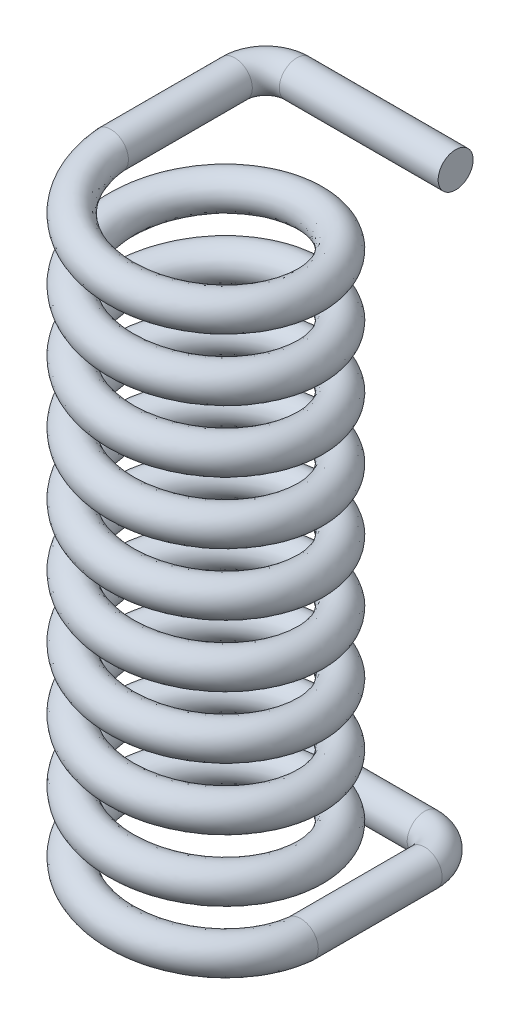
from build123d import *

# Parameters (mm, degrees)
SWEEP1_PITCH       = 4
SWEEP1_HEIGHT      = 38
SWEEP1_RADIUS      = 6.13
SWEEP1_START_ANGLE = 90
SKETCH1_R          = 1.13
SKETCH1_3_R        = 1.13
SWEEP3_OUTLINE_R   = 1.13
SWEEP3_ANGLE       = 90
SWEEP3_START       = -8.0000001
SWEEP3_2_OUTLINE_R = 1.13
SWEEP3_2_DEPTH     = 8.0000001
SWEEP3_START_2     = -4.1300001
SWEEP3_3_OUTLINE_R = 1.13
SWEEP3_3_DEPTH     = 10.2600001


with BuildPart() as part:
    # Sweep1: sweep along a helix
    with BuildLine() as sweep1_path:
        add(Helix(SWEEP1_PITCH, SWEEP1_HEIGHT, SWEEP1_RADIUS, center=(0, 0, 0), direction=(0, 1, 0), lefthand=True, mode=Mode.PRIVATE).rotate(Axis((0, 0, 0), (0, 1, 0)), SWEEP1_START_ANGLE))
    # Sketch1 → Sweep1 (sweep)
    with BuildSketch(Plane.XY):
        with Locations((6.13, 0)):
            Circle(SKETCH1_R)
    sweep(path=sweep1_path.line, is_frenet=True)

    # Sweep2: sweep along a path in Sketch3
    with BuildLine(Plane(origin=(0, 0, 0), x_dir=(1, 0, 0), z_dir=(0, 1, 0))) as sweep2_path:
        Line((6.13, 0), (6.13, 8))
        ThreePointArc((6.13, 8), (5.544213562, 9.414213562), (4.13, 10))
        Line((4.13, 10), (-6.13, 10))
    # Sketch1<3> → Sweep2 (sweep)
    with BuildSketch(Plane.XY):
        with Locations((6.13, 0)):
            Circle(SKETCH1_3_R)
    sweep(path=sweep2_path.line)



with BuildPart() as body_2:
    # Sweep3: read off the stored shape, not the designer's step
    # Sweep3 outline → Sweep3 (revolve)
    with BuildSketch(Plane(origin=(-4.13, 0, -8), x_dir=(0, 0, -1), z_dir=(1, 0, 0))):
        with Locations((2, 38)):
            Circle(SWEEP3_OUTLINE_R)
    revolve(axis=Axis((-4.13, 0, -8), (0, 1, 0)), revolution_arc=SWEEP3_ANGLE)


with BuildPart() as part_1:
    add(part.part)

    add(body_2.part)  # Sweep3 2 merges body 2
    # Sweep3 2 outline → Sweep3 2 (add)
    with BuildSketch(Plane.XY.offset(SWEEP3_START)):
        with Locations((-6.13, 38)):
            Circle(SWEEP3_2_OUTLINE_R)
    extrude(amount=SWEEP3_2_DEPTH)

    # Sweep3 3 outline → Sweep3 3 (add)
    with BuildSketch(Plane.YZ.offset(SWEEP3_START_2)):
        with Locations((38, -10)):
            Circle(SWEEP3_3_OUTLINE_R)
    extrude(amount=SWEEP3_3_DEPTH)


solid = part_1.part
